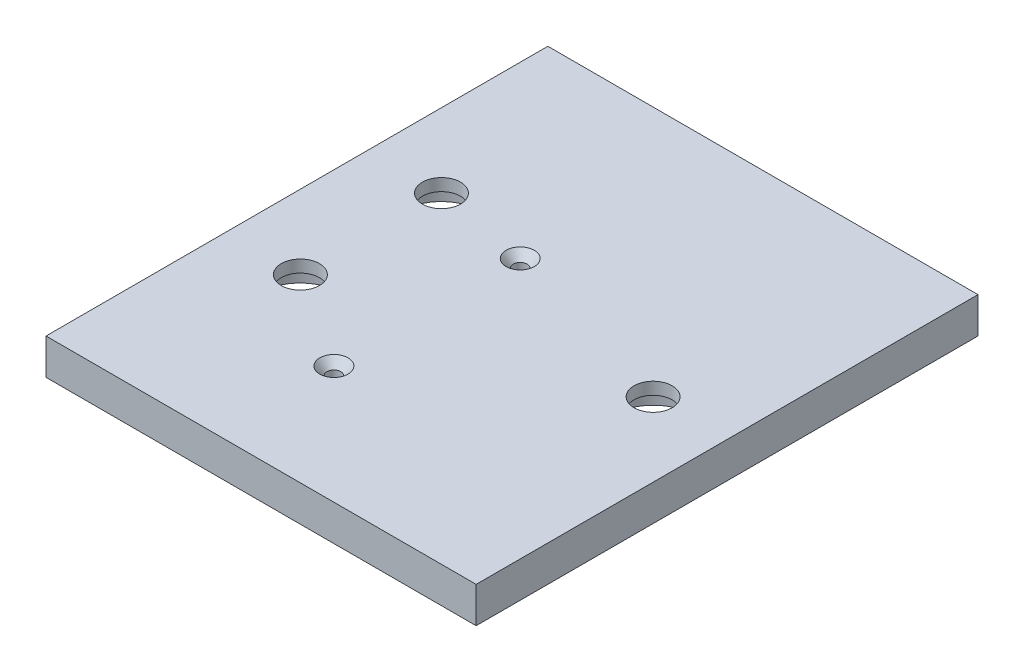
from build123d import *

# Parameters (mm, degrees)
SKETCH1_W                                            = 76.2
SKETCH1_H                                            = 88.9
BOSS_EXTRUDE1_DEPTH                                  = 6.35
CSK_FOR_2_FLAT_HEAD_SOCKET_CAP_SCREW1_D              = 2.4384
CSK_FOR_2_FLAT_HEAD_SOCKET_CAP_SCREW1_DEPTH          = 6.4
CSK_FOR_2_FLAT_HEAD_SOCKET_CAP_SCREW1_CSINK_D        = 5.0038
CSK_FOR_2_FLAT_HEAD_SOCKET_CAP_SCREW1_CSINK_ANGLE    = 82
CSK_FOR_2_FLAT_HEAD_SOCKET_CAP_SCREW1_TIP            = 0.732569267
CBORE_FOR_1_4_BINDING_HEAD_MACHINE_SCREW_D           = 6.7564
CBORE_FOR_1_4_BINDING_HEAD_MACHINE_SCREW_DEPTH       = 6.4
CBORE_FOR_1_4_BINDING_HEAD_MACHINE_SCREW_CBORE_D     = 14.2875
CBORE_FOR_1_4_BINDING_HEAD_MACHINE_SCREW_CBORE_DEPTH = 4.191
CBORE_FOR_1_4_BINDING_HEAD_MACHINE_SCREW_TIP         = 2.029827343


with BuildPart() as part:
    # Sketch1 → Boss-Extrude1 (new body)
    with BuildSketch(Plane(origin=(0, 0, 0), x_dir=(1, 0, 0), z_dir=(0, 1, 0))):
        with Locations((38.1, 44.45)):
            Rectangle(SKETCH1_W, SKETCH1_H)
    extrude(amount=BOSS_EXTRUDE1_DEPTH)

    # CSK for #2 Flat Head Socket Cap Screw1
    with Locations(Plane(origin=(0, 6.35, 0), x_dir=(1, 0, 0), z_dir=(0, 1, 0))):
        with Locations((30.1, 20.9), (30.1, 53.9)):
            CounterSinkHole(CSK_FOR_2_FLAT_HEAD_SOCKET_CAP_SCREW1_D / 2, CSK_FOR_2_FLAT_HEAD_SOCKET_CAP_SCREW1_CSINK_D / 2, depth=CSK_FOR_2_FLAT_HEAD_SOCKET_CAP_SCREW1_DEPTH, counter_sink_angle=CSK_FOR_2_FLAT_HEAD_SOCKET_CAP_SCREW1_CSINK_ANGLE)
            with Locations((0, 0, -(CSK_FOR_2_FLAT_HEAD_SOCKET_CAP_SCREW1_DEPTH + CSK_FOR_2_FLAT_HEAD_SOCKET_CAP_SCREW1_TIP / 2))):  # 118° drill point
                Cone(0, CSK_FOR_2_FLAT_HEAD_SOCKET_CAP_SCREW1_D / 2, CSK_FOR_2_FLAT_HEAD_SOCKET_CAP_SCREW1_TIP, mode=Mode.SUBTRACT)

    # CBORE for 1/4 Binding Head Machine Screw1
    with Locations(Plane(origin=(0, 0, 0), x_dir=(-1, 0, 0), z_dir=(0, -1, 0))):
        with Locations((-63.0936, 44.45), (-13.1064, 31.9532), (-13.1064, 56.9468)):
            CounterBoreHole(CBORE_FOR_1_4_BINDING_HEAD_MACHINE_SCREW_D / 2, CBORE_FOR_1_4_BINDING_HEAD_MACHINE_SCREW_CBORE_D / 2, CBORE_FOR_1_4_BINDING_HEAD_MACHINE_SCREW_CBORE_DEPTH, depth=CBORE_FOR_1_4_BINDING_HEAD_MACHINE_SCREW_DEPTH)
            with Locations((0, 0, -(CBORE_FOR_1_4_BINDING_HEAD_MACHINE_SCREW_DEPTH + CBORE_FOR_1_4_BINDING_HEAD_MACHINE_SCREW_TIP / 2))):  # 118° drill point
                Cone(0, CBORE_FOR_1_4_BINDING_HEAD_MACHINE_SCREW_D / 2, CBORE_FOR_1_4_BINDING_HEAD_MACHINE_SCREW_TIP, mode=Mode.SUBTRACT)


solid = part.part
